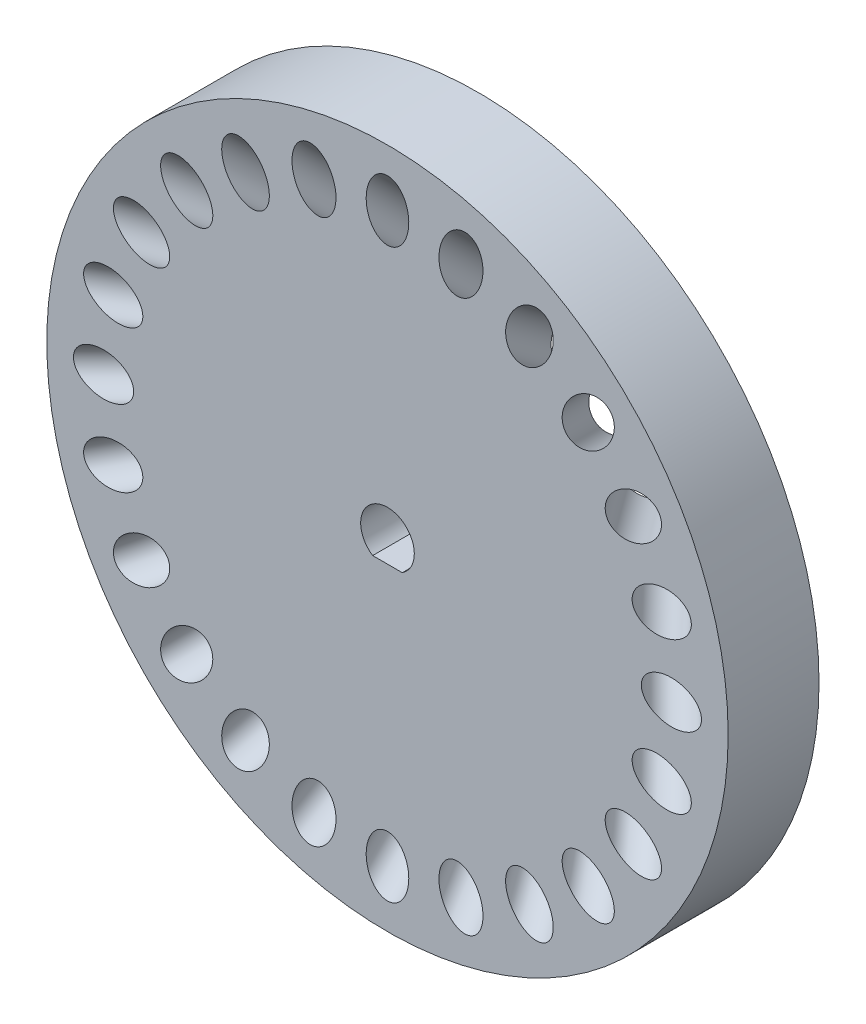
from build123d import *

# Parameters (mm, degrees)
SKETCH1_R           = 38.1
BOSS_EXTRUDE1_DEPTH = 10.16
SKETCH5_R           = 2.38125
CUT_EXTRUDE1_DEPTH  = 68.947967225
CIRPATTERN1_COUNT   = 24


with BuildPart() as part:
    # Sketch1 → Boss-Extrude1 (new body)
    with BuildSketch(Plane.XY):
        Circle(SKETCH1_R)
        with BuildLine():
            Line((-1.658312395, -2.5), (1.658312395, -2.5))
            ThreePointArc((1.658312395, -2.5), (0, 3), (-1.658312395, -2.5))
        make_face(mode=Mode.SUBTRACT)
    extrude(amount=BOSS_EXTRUDE1_DEPTH)

    # Sketch5 → Cut-Extrude1 (cut, symmetric)
    with BuildSketch(Plane(origin=(0, 15.875, 15.875), x_dir=(0, 0.7071067811865476, -0.7071067811865475), z_dir=(0, -0.7071067811865475, -0.7071067811865476))):
        with Locations((15.266435406, 0)):
            Circle(SKETCH5_R)
    cut_extrude1 = extrude(amount=CUT_EXTRUDE1_DEPTH, both=True, mode=Mode.SUBTRACT)

    # CirPattern1: Cut-Extrude1 ×24 about axis
    cirpattern1_axis = Axis((0, 0, 10.16), (0, 0, -1))
    for i in range(1, CIRPATTERN1_COUNT):
        add(cut_extrude1.rotate(cirpattern1_axis, i * 360 / CIRPATTERN1_COUNT), mode=Mode.SUBTRACT)


solid = part.part
